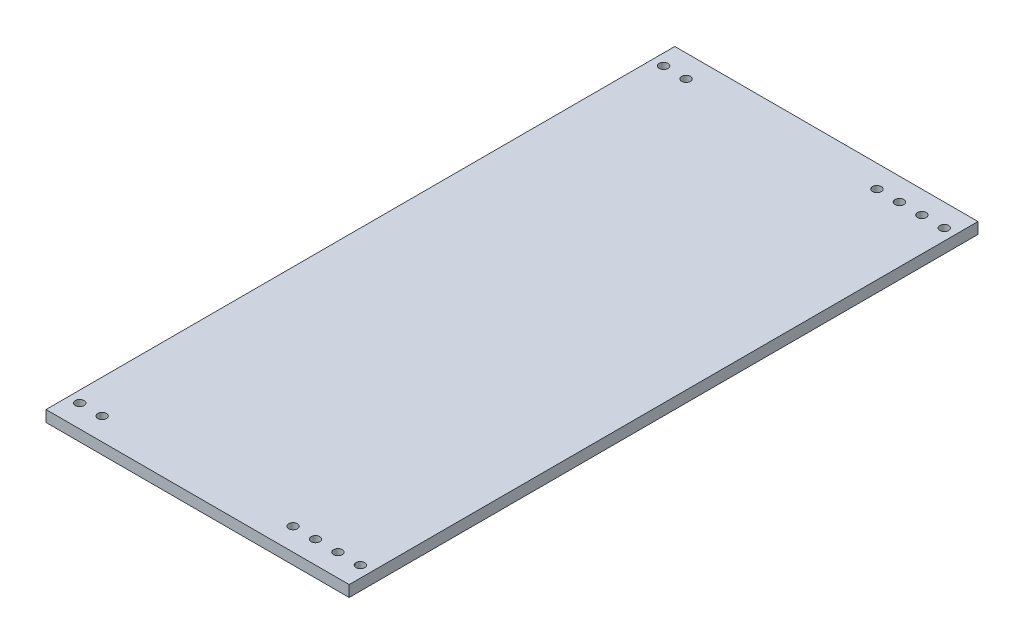
from build123d import *

# Parameters (mm, degrees)
SKETCH1_W           = 171.45
SKETCH1_H           = 355.6
BOSS_EXTRUDE1_DEPTH = 6.35
SKETCH2_R           = 2.4892
CUT_EXTRUDE2_DEPTH  = 198.489083559


with BuildPart() as part:
    # Sketch1 → Boss-Extrude1 (new body)
    with BuildSketch(Plane(origin=(0, 0, 0), x_dir=(1, 0, 0), z_dir=(0, 1, 0))):
        Rectangle(SKETCH1_W, SKETCH1_H)
    extrude(amount=BOSS_EXTRUDE1_DEPTH)

    # Sketch2 → Cut-Extrude2 (cut, through all)
    with BuildSketch(Plane(origin=(0, 6.35, 0), x_dir=(1, 0, 0), z_dir=(0, 1, 0))):
        with Locations((79.375, -165.1)):
            Circle(SKETCH2_R)
        with Locations((66.675, -165.1)):
            Circle(SKETCH2_R)
        with Locations((53.975, -165.1)):
            Circle(SKETCH2_R)
        with Locations((41.275, -165.1)):
            Circle(SKETCH2_R)
        with Locations((79.375, 165.1)):
            Circle(SKETCH2_R)
        with Locations((66.675, 165.1)):
            Circle(SKETCH2_R)
        with Locations((53.975, 165.1)):
            Circle(SKETCH2_R)
        with Locations((41.275, 165.1)):
            Circle(SKETCH2_R)
        with Locations((-79.375, -165.1)):
            Circle(SKETCH2_R)
        with Locations((-66.675, -165.1)):
            Circle(SKETCH2_R)
        with Locations((-79.375, 165.1)):
            Circle(SKETCH2_R)
        with Locations((-66.675, 165.1)):
            Circle(SKETCH2_R)
    extrude(amount=-CUT_EXTRUDE2_DEPTH, mode=Mode.SUBTRACT)


solid = part.part
